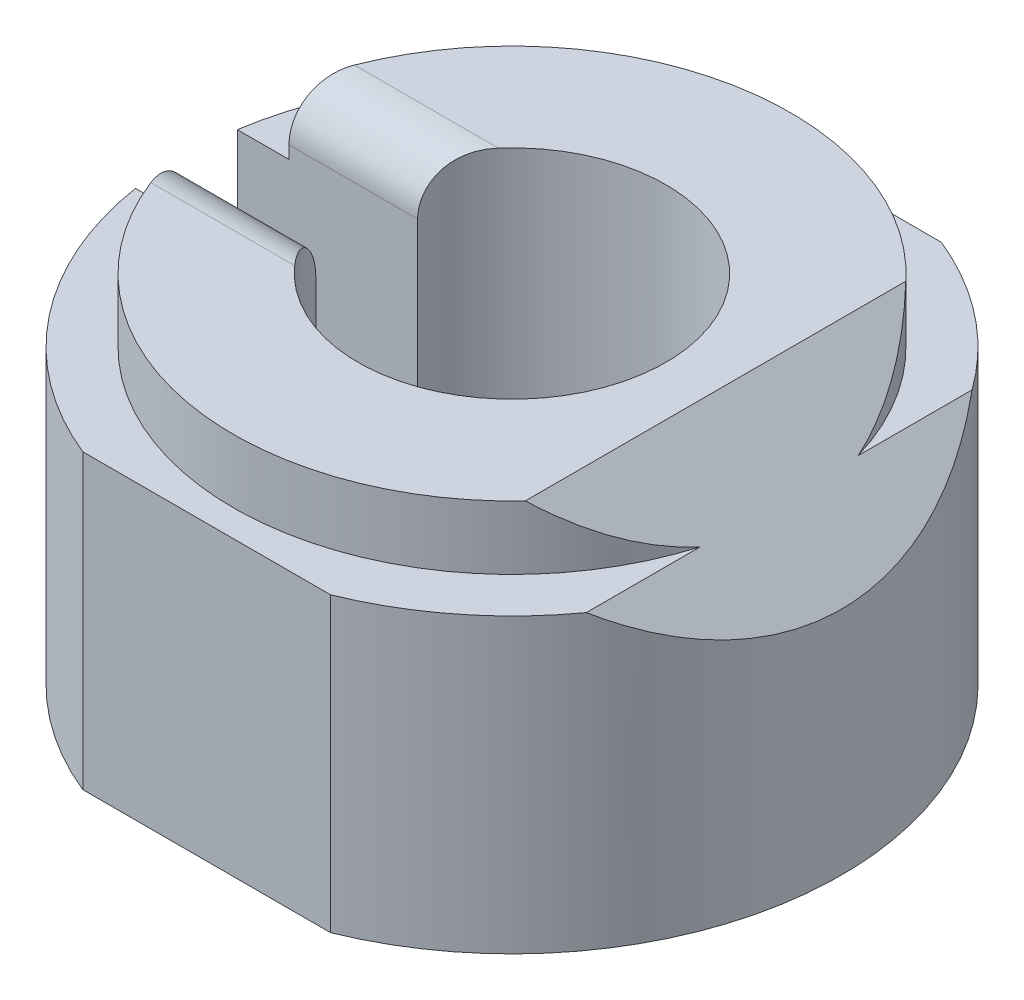
from build123d import *

# Parameters (mm, degrees)
SKETCH1_R               = 10.95
SKETCH1_R_2             = 6.05
BOSS_EXTRUDE1_DEPTH     = 2
BOSS_EXTRUDE2_START     = 12
SKETCH1_3_R             = 10.95
SKETCH1_3_R_2           = 6.05
BOSS_EXTRUDE2_DEPTH     = 12
BOSS_EXTRUDE3_START     = -2.5
SKETCH2_R               = 12.95
SKETCH2_R_2             = 10.95
BOSS_EXTRUDE3_DEPTH     = 11.5
CUT_EXTRUDE1_DEPTH      = 22.895319134
CUT_EXTRUDE1_DEPTH_BACK = 22.895319134
SKETCH3_W               = 100
SKETCH3_H               = 24
CUT_EXTRUDE3_DEPTH      = 22.347189511
CUT_EXTRUDE3_DEPTH_BACK = 22.347189511
SKETCH5_W               = 18
SKETCH5_H               = 4
CUT_EXTRUDE4_DEPTH      = 22.347189511
FILLET1_R               = 2
CUT_EXTRUDE5_DEPTH      = 22.347189684
CUT_EXTRUDE5_DEPTH_BACK = 22.347189684
SKETCH6_R               = 1.6


with BuildPart() as part:
    # Sketch1 → Boss-Extrude1 (new body)
    # profile 1 of 2: a face of its own
    with BuildSketch(Plane(origin=(0, 0, 0), x_dir=(1, 0, 0), z_dir=(0, 1, 0))):
        with Locations(Location((0, 0, 0), (0, 0, 270))):
            Circle(SKETCH1_R)
        Circle(SKETCH1_R_2, mode=Mode.SUBTRACT)
    # profile 2 of 2: a face of its own
    with BuildSketch(Plane(origin=(0, 0, 0), x_dir=(1, 0, 0), z_dir=(0, 1, 0))):
        Circle(SKETCH1_R_2)
    extrude(amount=-BOSS_EXTRUDE1_DEPTH)

    # Sketch1<3> → Boss-Extrude2 (add)
    with BuildSketch(Plane(origin=(0, 0, 0), x_dir=(1, 0, 0), z_dir=(0, 1, 0)).offset(BOSS_EXTRUDE2_START)):
        with Locations(Location((0, 0, 0), (0, 0, 270))):
            Circle(SKETCH1_3_R)
        with Locations(Location((0, 0, 0), (0, 0, 270))):
            Circle(SKETCH1_3_R_2, mode=Mode.SUBTRACT)
    extrude(amount=-BOSS_EXTRUDE2_DEPTH)

    # Sketch2 → Boss-Extrude3 (add)
    with BuildSketch(Plane(origin=(0, 12, 0), x_dir=(1, 0, 0), z_dir=(0, 1, 0)).offset(BOSS_EXTRUDE3_START)):
        with Locations(Location((0, 0, 0), (0, 0, 270))):
            Circle(SKETCH2_R)
        with Locations(Location((0, 0, 0), (0, 0, 270))):
            Circle(SKETCH2_R_2, mode=Mode.SUBTRACT)
    extrude(amount=-BOSS_EXTRUDE3_DEPTH)

    # Sketch3 → Cut-Extrude1 (cut, two sides: drawn at the far end of the back side and taken through both)
    with BuildSketch(Plane(origin=(0, 0, 0), x_dir=(1, 0, 0), z_dir=(0, 1, 0)).offset(-CUT_EXTRUDE1_DEPTH_BACK)):
        with Locations((0, -24)):
            Rectangle(SKETCH3_W, SKETCH3_H)
        with Locations((0, 24)):
            Rectangle(SKETCH3_W, SKETCH3_H)
    extrude(amount=CUT_EXTRUDE1_DEPTH + CUT_EXTRUDE1_DEPTH_BACK, mode=Mode.SUBTRACT)

    # Sketch4 → Cut-Extrude3 (cut, two sides: drawn at the far end of the back side and taken through both)
    with BuildSketch(Plane.XY.offset(-CUT_EXTRUDE3_DEPTH_BACK)):
        Polygon((13, 15), (5, 15), (13, 7), align=None)
    extrude(amount=CUT_EXTRUDE3_DEPTH + CUT_EXTRUDE3_DEPTH_BACK, mode=Mode.SUBTRACT)

    # Sketch5 → Cut-Extrude4 (cut, through all)
    with BuildSketch(Plane(origin=(0, 0, 0), x_dir=(1, 0, 0), z_dir=(0, 1, 0))):
        with Locations((-11, 0)):
            Rectangle(SKETCH5_W, SKETCH5_H)
    extrude(amount=CUT_EXTRUDE4_DEPTH, mode=Mode.SUBTRACT)

    # Fillet1
    fillet1_edges = [part.edges().sort_by_distance(p)[0] for p in [
        (-8.237831116, 12, 2),
        (-8.237831116, 12, -2),
        (-9.252243836, 0, -2),
        (-9.252243836, 0, 2),
    ]]
    fillet(fillet1_edges, radius=FILLET1_R - 0.0001)  # a hair under: the kernel refuses the full size

    # Sketch6 → Cut-Extrude5 (cut, two sides: drawn at the far end of the back side and taken through both)
    with BuildSketch(Plane(origin=(0, 0, 0), x_dir=(1, 0, 0), z_dir=(0, 1, 0)).offset(-CUT_EXTRUDE5_DEPTH_BACK)):
        with Locations(Location((0, 0, 0), (0, 0, 270))):
            Circle(SKETCH6_R)
    extrude(amount=CUT_EXTRUDE5_DEPTH + CUT_EXTRUDE5_DEPTH_BACK, mode=Mode.SUBTRACT)


solid = part.part
